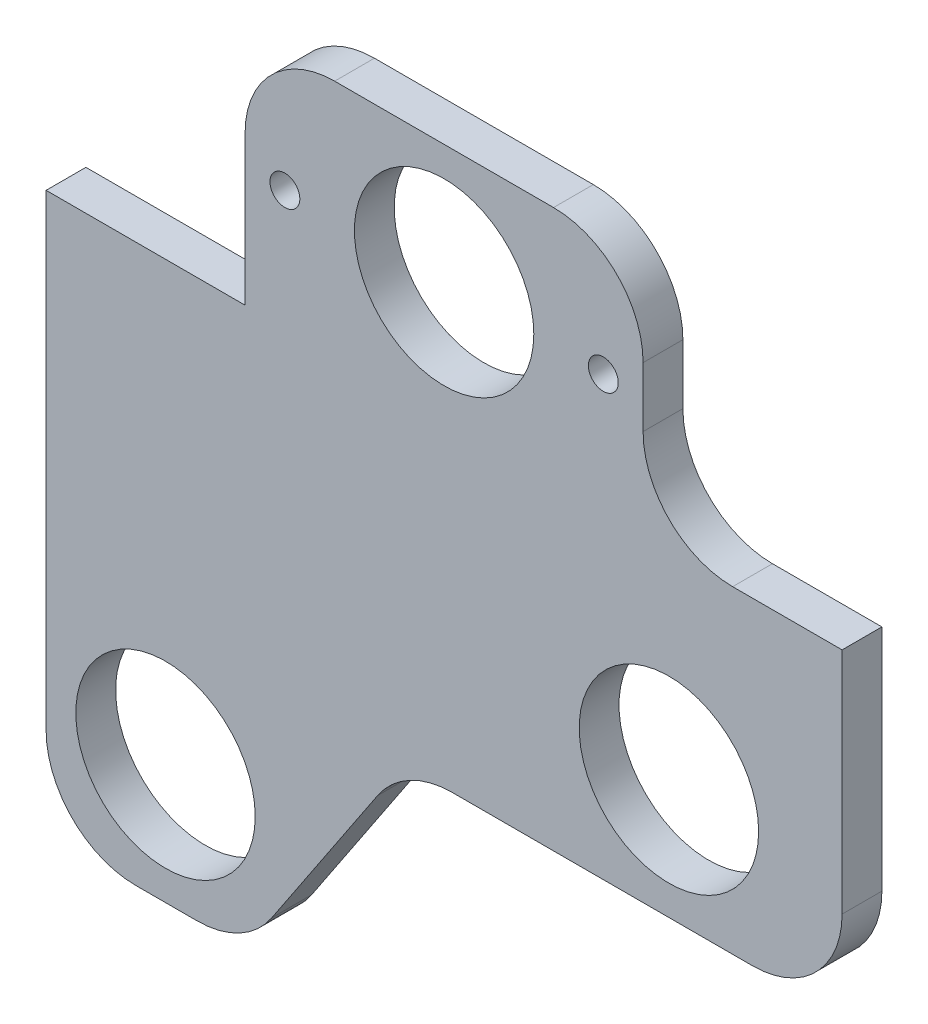
from build123d import *

# Parameters (mm, degrees)
SKETCH1_R           = 14.3129
BOSS_EXTRUDE1_DEPTH = 6.35
FILLET1_R           = 14.2875
SKETCH2_W           = 63.5
SKETCH2_H           = 38.1
BOSS_EXTRUDE2_DEPTH = 6.35
FILLET2_R           = 14.2875
SKETCH3_R           = 14.3129
CUT_EXTRUDE1_DEPTH  = 105.341147205
SKETCH4_R           = 2.38125
SKETCH4_R_2         = 14.2875
CUT_EXTRUDE2_DEPTH  = 105.341147205


with BuildPart() as part:
    # Sketch1 → Boss-Extrude1 (new body)
    with BuildSketch(Plane.XY):
        Polygon((-6.35, -6.35), (63.5, -6.35), (63.5, 44.45), (-63.5, 44.45), (-63.5, -44.45), (-31.75, -44.45), align=None)
        with Locations((-44.45, -25.4)):
            Circle(SKETCH1_R, mode=Mode.SUBTRACT)
        with Locations((35.871852568, 12.7)):
            Circle(SKETCH1_R, mode=Mode.SUBTRACT)
    extrude(amount=BOSS_EXTRUDE1_DEPTH)

    # Fillet1
    fillet1_edges = [part.edges().sort_by_distance(p)[0] for p in [
        (63.5, -6.35, 3.175),
        (-6.35, -6.35, 3.175),
        (-31.75, -44.45, 3.175),
        (-63.5, -44.45, 3.175),
    ]]
    fillet(fillet1_edges, radius=FILLET1_R)

    # Sketch2 → Boss-Extrude2 (add)
    with BuildSketch(Plane.XY.offset(6.35)):
        with Locations((0, 63.5)):
            Rectangle(SKETCH2_W, SKETCH2_H)
    extrude(amount=-BOSS_EXTRUDE2_DEPTH)

    # Fillet2
    fillet2_edges = [part.edges().sort_by_distance(p)[0] for p in [
        (-31.75, 82.55, 3.175),
        (31.75, 82.55, 3.175),
        (31.75, 44.45, 3.175),
    ]]
    fillet(fillet2_edges, radius=FILLET2_R)

    # Sketch3 → Cut-Extrude1 (cut, through all)
    with BuildSketch(Plane.XY.offset(6.35)):
        with Locations((0, 63.5)):
            Circle(SKETCH3_R)
    extrude(amount=-CUT_EXTRUDE1_DEPTH, mode=Mode.SUBTRACT)

    # Sketch4 → Cut-Extrude2 (cut, through all)
    with BuildSketch(Plane.XY.offset(6.35)):
        with Locations((-25.4, 63.5)):
            Circle(SKETCH4_R)
        with Locations((25.4, 63.5)):
            Circle(SKETCH4_R)
        with Locations((0, 63.5)):
            Circle(SKETCH4_R_2)
    extrude(amount=-CUT_EXTRUDE2_DEPTH, mode=Mode.SUBTRACT)


solid = part.part
